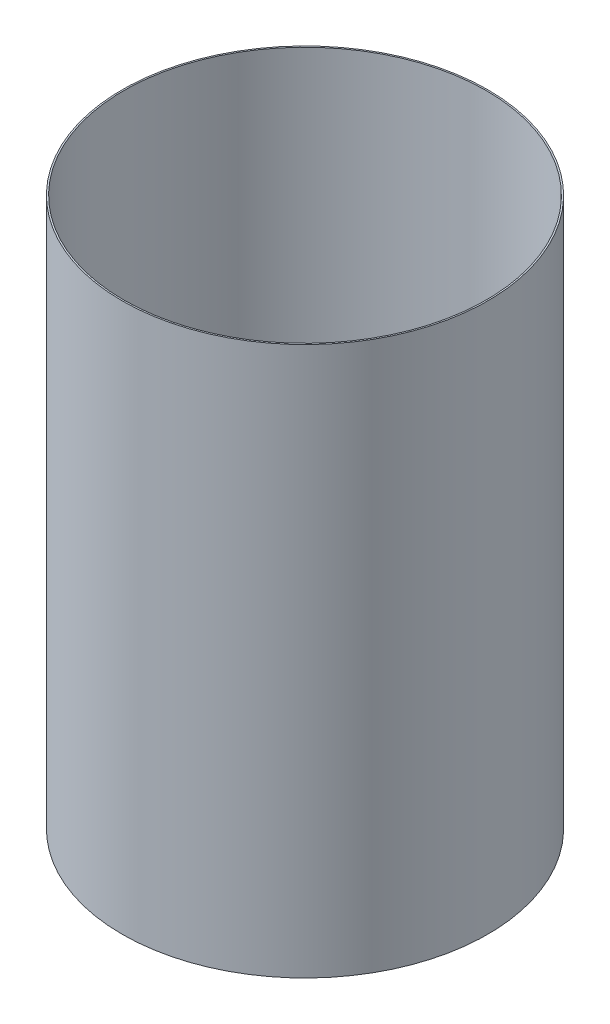
from build123d import *

# Parameters (mm, degrees)
SKETCH2_R           = 152.4
SKETCH2_R_2         = 151.13
BOSS_EXTRUDE1_DEPTH = 457.2


with BuildPart() as part:
    # Sketch2 → Boss-Extrude1 (new body)
    with BuildSketch(Plane(origin=(0, 0, 0), x_dir=(1, 0, 0), z_dir=(0, 1, 0))):
        Circle(SKETCH2_R)
        Circle(SKETCH2_R_2, mode=Mode.SUBTRACT)
    extrude(amount=BOSS_EXTRUDE1_DEPTH)


solid = part.part
